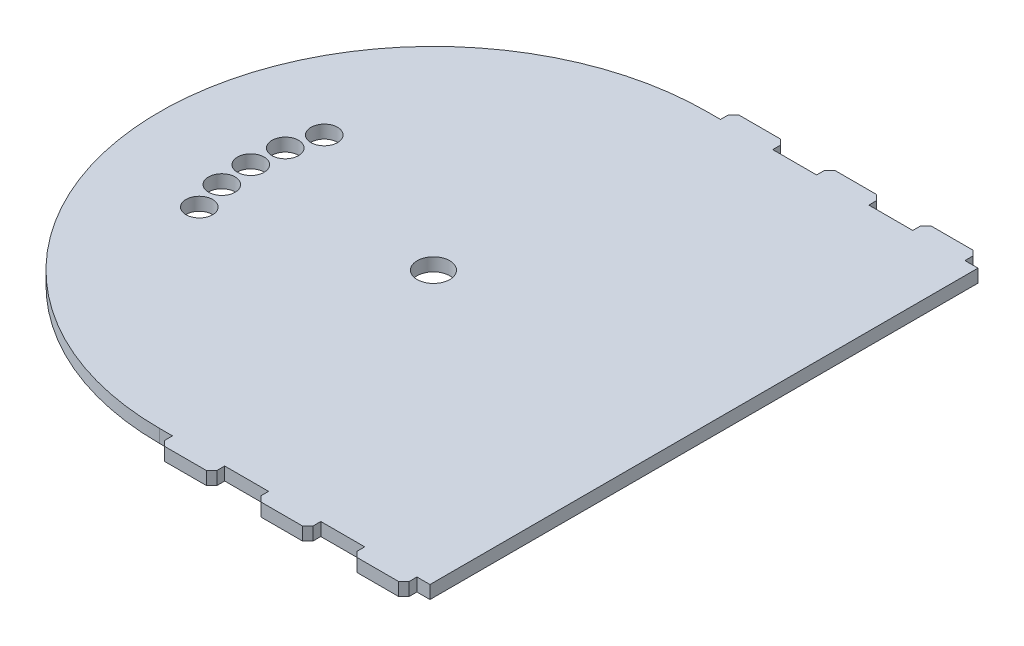
from build123d import *

# Parameters (mm, degrees)
SM_BASE_FLANGE_1_DEPTH = 5
OTHER_START            = -5
OTHER_1_DEPTH          = 5
SKETCH_8_R             = 5.1
CUT_EXTRUDE_1_DEPTH    = 153.151240547


# Read off the part's stored shape, not the designer's step: Выступы и прорези-Выступ1
# Sheet-metal steps are written as plain solids
with BuildPart() as part:
    # Sketch 1 → Базовая кромка1 (new body)
    with BuildSketch(Plane(origin=(0, 0, 0), x_dir=(1, 0, 0), z_dir=(0, 1, 0))):
        with BuildLine():
            Line((0, -105), (103.662809462, -105))
            Line((103.662809462, -105), (103.662809462, 0))
            Line((103.662809462, 0), (6.25, 0))
            ThreePointArc((6.25, 0), (0, -6.25), (-6.25, 0))
            Line((-6.25, 0), (-105, 0))
            ThreePointArc((-105, 0), (-74.246212025, -74.246212025), (0, -105))
        make_face()
    extrude(amount=-SM_BASE_FLANGE_1_DEPTH)

    # Other 1 outline → Other 1 (add)
    with BuildSketch(Plane(origin=(0, 0, 0), x_dir=(1, 0, 0), z_dir=(0, 1, 0)).offset(OTHER_START)):
        Polygon((98.662809462, -105), (78.662809462, -105), (78.662809462, -108), (80.662809462, -110), (96.662809462, -110), (98.662809462, -108), align=None)
        Polygon((61.831404731, -105), (41.831404731, -105), (41.831404731, -108), (43.831404731, -110), (59.831404731, -110), (61.831404731, -108), align=None)
        Polygon((5, -105), (5, -108), (7, -110), (23, -110), (25, -108), (25, -105), align=None)
    extrude(amount=OTHER_1_DEPTH)

    # Зеркальное отражение1: part across plane


with BuildPart() as part_1:
    add(part.part)
    add(part.part.mirror(Plane(origin=(6.25, -5, 0), x_dir=(1, 0, 0), z_dir=(0, 0, -1))))

    # Эскиз8 → Вырез-Вытянуть1 (cut, through all)
    with BuildSketch(Plane(origin=(0, 0, 0), x_dir=(1, 0, 0), z_dir=(0, 1, 0))):
        with Locations(Location((-65.778483455, 23.941410033, 0), (0, 0, 270))):
            Circle(SKETCH_8_R)
        with Locations(Location((-68.936542711, 12.155372437, 0), (0, 0, 270))):
            Circle(SKETCH_8_R)
        with Locations(Location((-70, 0, 0), (0, 0, 270))):
            Circle(SKETCH_8_R)
        with Locations(Location((-68.936542711, -12.155372437, 0), (0, 0, 270))):
            Circle(SKETCH_8_R)
        with Locations(Location((-65.778483455, -23.941410033, 0), (0, 0, 270))):
            Circle(SKETCH_8_R)
    extrude(amount=-CUT_EXTRUDE_1_DEPTH, mode=Mode.SUBTRACT)


solid = part_1.part
